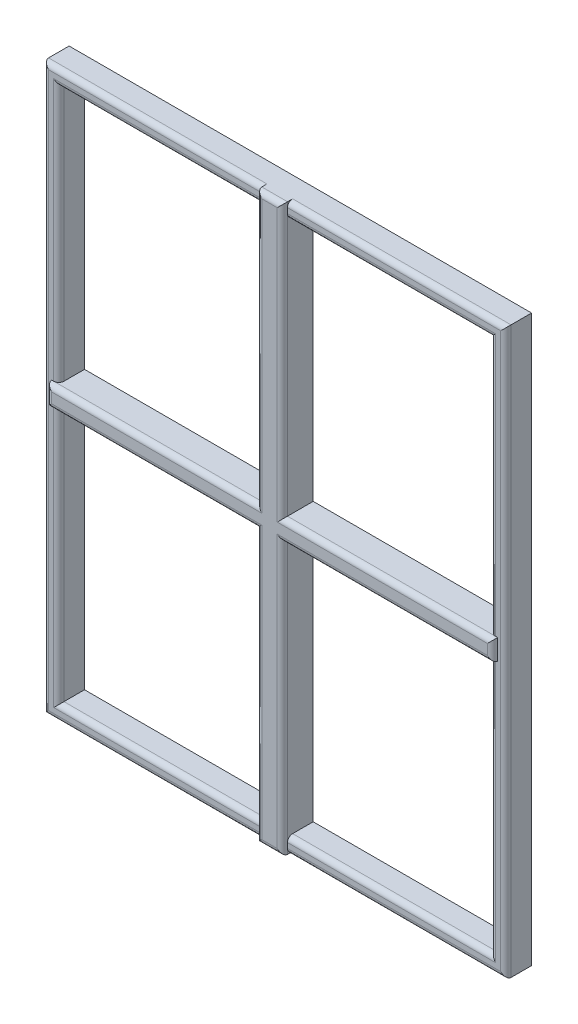
from build123d import *

# Parameters (mm, degrees)
SKETCH1_W           = 900
SKETCH1_H           = 1100
SKETCH1_W_2         = 840
SKETCH1_H_2         = 1040
BOSS_EXTRUDE1_DEPTH = 50
FILLET1_R           = 10
SKETCH2_W           = 50
SKETCH2_H           = 1100
SKETCH2_W_2         = 868
SKETCH2_H_2         = 40
BOSS_EXTRUDE2_DEPTH = 60
FILLET2_R           = 10


with BuildPart() as part:
    # Sketch1 → Boss-Extrude1 (new body)
    with BuildSketch(Plane.XY):
        with Locations((-450, 550)):
            Rectangle(SKETCH1_W, SKETCH1_H)
        with Locations((-450, 550)):
            Rectangle(SKETCH1_W_2, SKETCH1_H_2, mode=Mode.SUBTRACT)
    extrude(amount=BOSS_EXTRUDE1_DEPTH)

    # Fillet1
    fillet1_edges = [part.edges().sort_by_distance(p)[0] for p in [
        (-900, 550, 50),
        (-450, 0, 50),
        (-450, 30, 50),
        (-30, 550, 50),
        (-450, 1070, 50),
        (-870, 550, 50),
        (0, 550, 50),
        (-450, 1100, 50),
    ]]
    fillet(fillet1_edges, radius=FILLET1_R)

    # Sketch2 → Boss-Extrude2 (add)
    with BuildSketch(Plane.XY):
        with Locations((-450, 550)):
            Rectangle(SKETCH2_W, SKETCH2_H)
        with Locations((-450, 550)):
            Rectangle(SKETCH2_W_2, SKETCH2_H_2)
    extrude(amount=BOSS_EXTRUDE2_DEPTH)

    # Fillet2
    fillet2_edges = [part.edges().sort_by_distance(p)[0] for p in [
        (-450, 0, 60),
        (-475, 265, 60),
        (-679.5, 530, 60),
        (-884, 550, 60),
        (-679.5, 570, 60),
        (-475, 835, 60),
        (-450, 1100, 60),
        (-425, 835, 60),
        (-220.5, 570, 60),
        (-16, 550, 60),
        (-220.5, 530, 60),
        (-425, 265, 60),
    ]]
    fillet(fillet2_edges, radius=FILLET2_R - 0.0001)  # a hair under: the kernel refuses the full size


solid = part.part
